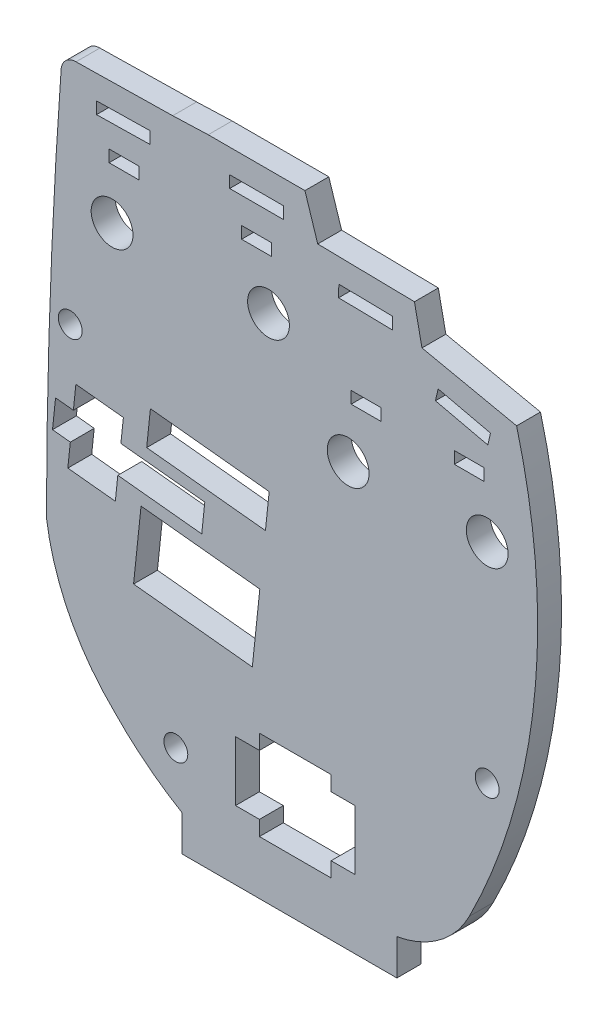
from build123d import *

# Parameters (mm, degrees)
SKETCH1_R           = 2
SKETCH1_R_2         = 3.5
SKETCH1_W           = 9
SKETCH1_H           = 2
SKETCH1_W_2         = 5
BOSS_EXTRUDE1_DEPTH = 4


with BuildPart() as part:
    # Sketch1 → Boss-Extrude1 (new body)
    with BuildSketch(Plane.XY):
        with BuildLine():
            Line((-18.458840994, 82.015701198), (-2.261308333, 82.298430785))
            Line((-2.261308333, 82.298430785), (3.681449055, 82.510000006))
            Line((3.681449055, 82.510000006), (19.881449055, 82.510000006))
            Line((19.881449055, 82.510000006), (22.024327192, 75.841009004))
            Line((22.024327192, 75.841009004), (38.221859853, 75.558279649))
            Line((38.221859853, 75.558279649), (39.484374594, 69.483950474))
            Line((39.484374594, 69.483950474), (55.330365726, 66.115781082))
            ThreePointArc((55.330365726, 66.115781082), (58.276211818, 27.829327454), (47.40737016, -8.999992681))
            ThreePointArc((47.40737016, -8.999992681), (42.406223169, -14.93064645), (35.281387451, -17.999985362))
            Line((35.281387451, -17.999985362), (35.281387451, -23.999985362))
            Line((35.281387451, -23.999985362), (-0.718612549, -23.999985362))
            Line((-0.718612549, -23.999985362), (-0.718612549, -17.999985362))
            ThreePointArc((-0.718612549, -17.999985362), (-6.700212282, -13.889110006), (-12.064479551, -8.999992681))
            ThreePointArc((-12.064479551, -8.999992681), (-19.61303693, 1.256548647), (-23.410346553, 13.412115197))
            ThreePointArc((-23.410346553, 13.412115197), (-22.767055089, 46.485509252), (-20.958840994, 79.515701198))
            ThreePointArc((-20.958840994, 79.515701198), (-20.226607947, 81.283468151), (-18.458840994, 82.015701198))
        make_face()
        with Locations((50.407370126, 11.821617405)):
            Circle(SKETCH1_R, mode=Mode.SUBTRACT)
        with Locations((-12.418931692, 61.651218734)):
            Circle(SKETCH1_R_2, mode=Mode.SUBTRACT)
        with Locations((13.781449056, 61.651218734)):
            Circle(SKETCH1_R_2, mode=Mode.SUBTRACT)
        with Locations((27.123093523, 46.821617405)):
            Circle(SKETCH1_R_2, mode=Mode.SUBTRACT)
        with Locations((50.407370126, 46.821617405)):
            Circle(SKETCH1_R_2, mode=Mode.SUBTRACT)
        with Locations((-19.421473279, 43.456405989)):
            Circle(SKETCH1_R, mode=Mode.SUBTRACT)
        with Locations((-1.739971617, -9.124358763)):
            Circle(SKETCH1_R, mode=Mode.SUBTRACT)
        with Locations((11.78144909, 77.509999643)):
            Rectangle(SKETCH1_W, SKETCH1_H, mode=Mode.SUBTRACT)
        Polygon((8.260028383, -2.5), (12.260028383, -2.5), (12.260028383, 0), (24.260028383, 0), (24.260028383, -2.5), (28.260028383, -2.5), (28.260028383, -12.5), (24.260028383, -12.5), (24.260028383, -15), (12.260028383, -15), (12.260028383, -12.5), (8.260028383, -12.5), align=None, mode=Mode.SUBTRACT)
        with Locations((47.407370126, 56.321617405)):
            Rectangle(SKETCH1_W_2, SKETCH1_H, mode=Mode.SUBTRACT)
        Polygon((-15.057865572, 78.071464466), (-6.059236316, 78.228536124), (-6.024331503, 76.228840733), (-15.022960759, 76.071769076), align=None, mode=Mode.SUBTRACT)
        with Locations((30.123093523, 56.399848624)):
            Rectangle(SKETCH1_W_2, SKETCH1_H, mode=Mode.SUBTRACT)
        with Locations((11.781449056, 71.151218734)):
            Rectangle(SKETCH1_W_2, SKETCH1_H, mode=Mode.SUBTRACT)
        Polygon((25.553969269, 71.778789554), (25.519064456, 69.779094163), (34.517693713, 69.622022505), (34.552598526, 71.621717896), align=None, mode=Mode.SUBTRACT)
        Polygon((50.960388654, 62.874995987), (42.191058071, 64.899555477), (41.741155962, 62.950815347), (50.510486546, 60.926255858), align=None, mode=Mode.SUBTRACT)
        Polygon((13.892947735, 35.852091538), (13.265776955, 29.884960166), (-6.624660952, 31.975529432), (-5.997490172, 37.942660804), align=None, mode=Mode.SUBTRACT)
        with Locations((-10.418931692, 71.151218734)):
            Rectangle(SKETCH1_W_2, SKETCH1_H, mode=Mode.SUBTRACT)
        Polygon((12.325020711, 20.934262752), (11.070679227, 9), (-8.819758773, 11.090569034), (-7.565417198, 23.024832005), align=None, mode=Mode.SUBTRACT)
        Polygon((2.597827155, 24.068199743), (3.110016625, 28.94135703), (-10.944069954, 30.418501052), (-10.525956101, 34.396588634), (-18.482131264, 35.23281634), (-18.900245117, 31.254728759), (-21.883810804, 31.568314148), (-22.396000274, 26.695156861), (-19.412434587, 26.381571471), (-19.830548441, 22.40348389), (-11.874373278, 21.567256184), (-11.456259424, 25.545343765), align=None, mode=Mode.SUBTRACT)
    extrude(amount=BOSS_EXTRUDE1_DEPTH)


solid = part.part
